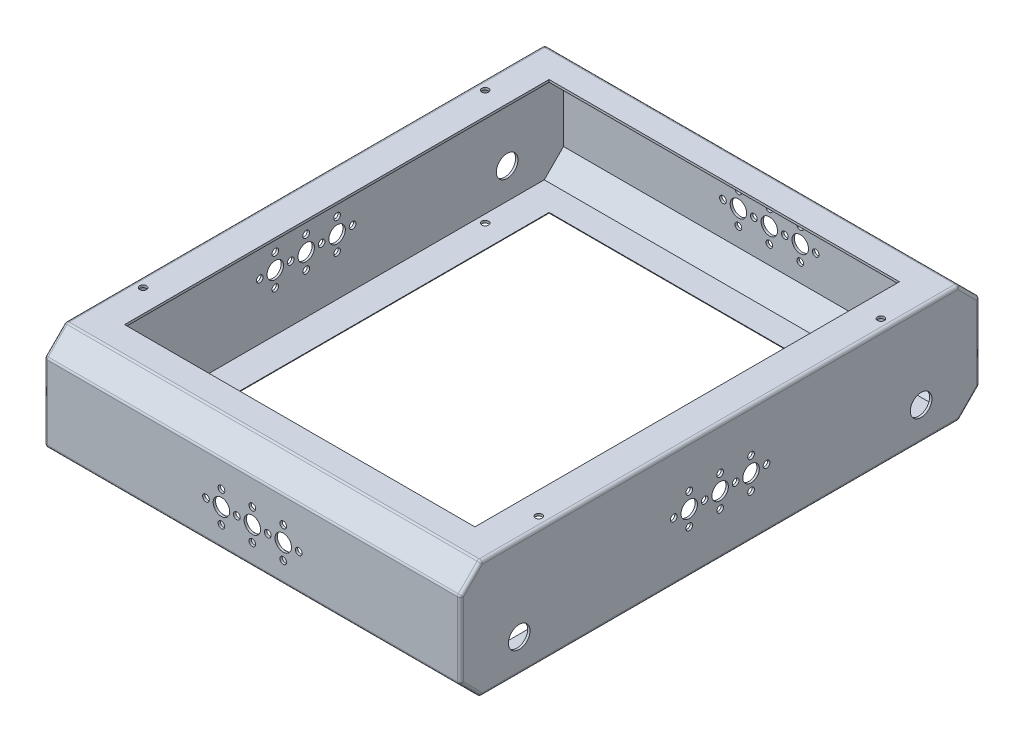
from build123d import *

# Parameters (mm, degrees)
SKETCH1_W           = 252
SKETCH1_H           = 57
BOSS_EXTRUDE1_DEPTH = 202
CUT_EXTRUDE1_DEPTH  = 328.958838881
SKETCH3_W           = 170
SKETCH3_H           = 206
CUT_EXTRUDE2_DEPTH  = 328.958838881
SHELL3_T            = -1.14
SKETCH4_R           = 4
SKETCH4_R_2         = 1.625
CUT_EXTRUDE3_DEPTH  = 328.958838881
SKETCH5_R           = 4
SKETCH5_R_2         = 1.625
CUT_EXTRUDE4_DEPTH  = 328.958838881
SKETCH6_R           = 5.25
CUT_EXTRUDE5_DEPTH  = 328.958838881
FILLET1_R           = 1.5
SKETCH7_R           = 1.65
CUT_EXTRUDE6_DEPTH  = 328.958838881


with BuildPart() as part:
    # Sketch1 → Boss-Extrude1 (new body)
    with BuildSketch(Plane(origin=(0, 0, 0), x_dir=(0, 0, -1), z_dir=(1, 0, 0))):
        with Locations((126, 28.5)):
            Rectangle(SKETCH1_W, SKETCH1_H)
    extrude(amount=BOSS_EXTRUDE1_DEPTH)

    # Sketch2 → Cut-Extrude1 (cut, through all)
    with BuildSketch(Plane.ZY):
        Polygon((-252, 47), (-242, 57), (-252, 57), align=None)
        Polygon((-252, 10), (-252, 0), (-242, 0), align=None)
        Polygon((0, 10), (-10, 0), (0, 0), align=None)
        Polygon((0, 47), (0, 57), (-10, 57), align=None)
    extrude(amount=-CUT_EXTRUDE1_DEPTH, mode=Mode.SUBTRACT)

    # Sketch3 → Cut-Extrude2 (cut, through all)
    with BuildSketch(Plane.XZ):
        with Locations((101, -126)):
            Rectangle(SKETCH3_W, SKETCH3_H)
    extrude(amount=-CUT_EXTRUDE2_DEPTH, mode=Mode.SUBTRACT)

    # Shell3
    shell3_openings = [part.faces().sort_by_distance(p)[0] for p in [
        (16, 28.5, -126),
        (101, 28.5, -23),
        (186, 28.5, -126),
        (101, 28.5, -229),
    ]]
    offset(amount=SHELL3_T, openings=shell3_openings, kind=Kind.INTERSECTION)

    # Sketch4 → Cut-Extrude3 (cut, through all)
    with BuildSketch(Plane(origin=(202, 0, 0), x_dir=(0, 0, -1), z_dir=(1, 0, 0))):
        with Locations((126, 28.5)):
            Circle(SKETCH4_R)
        with Locations((141, 28.5)):
            Circle(SKETCH4_R)
        with Locations((111, 28.5)):
            Circle(SKETCH4_R)
        with Locations((126, 36)):
            Circle(SKETCH4_R_2)
        with Locations((126, 21)):
            Circle(SKETCH4_R_2)
        with Locations((133.5, 28.5)):
            Circle(SKETCH4_R_2)
        with Locations((141, 21)):
            Circle(SKETCH4_R_2)
        with Locations((148.5, 28.5)):
            Circle(SKETCH4_R_2)
        with Locations((118.5, 28.5)):
            Circle(SKETCH4_R_2)
        with Locations((103.5, 28.5)):
            Circle(SKETCH4_R_2)
        with Locations((111, 36)):
            Circle(SKETCH4_R_2)
        with Locations((111, 21)):
            Circle(SKETCH4_R_2)
        with Locations((141, 36)):
            Circle(SKETCH4_R_2)
    extrude(amount=-CUT_EXTRUDE3_DEPTH, mode=Mode.SUBTRACT)

    # Sketch5 → Cut-Extrude4 (cut, through all)
    with BuildSketch(Plane.XY):
        with Locations((101, 26.875)):
            Circle(SKETCH5_R)
        with Locations((116, 26.875)):
            Circle(SKETCH5_R)
        with Locations((86, 26.875)):
            Circle(SKETCH5_R)
        with Locations((101, 34.375)):
            Circle(SKETCH5_R_2)
        with Locations((101, 19.375)):
            Circle(SKETCH5_R_2)
        with Locations((108.5, 26.875)):
            Circle(SKETCH5_R_2)
        with Locations((116, 19.375)):
            Circle(SKETCH5_R_2)
        with Locations((123.5, 26.875)):
            Circle(SKETCH5_R_2)
        with Locations((93.5, 26.875)):
            Circle(SKETCH5_R_2)
        with Locations((78.5, 26.875)):
            Circle(SKETCH5_R_2)
        with Locations((86, 34.375)):
            Circle(SKETCH5_R_2)
        with Locations((86, 19.375)):
            Circle(SKETCH5_R_2)
        with Locations((116, 34.375)):
            Circle(SKETCH5_R_2)
    extrude(amount=-CUT_EXTRUDE4_DEPTH, mode=Mode.SUBTRACT)

    # Sketch6 → Cut-Extrude5 (cut, through all)
    with BuildSketch(Plane(origin=(202, 0, 0), x_dir=(0, 0, -1), z_dir=(1, 0, 0))):
        with Locations((28.5, 16)):
            Circle(SKETCH6_R)
        with Locations(Location((223.5, 16, 0), (0, 0, 180))):
            Circle(SKETCH6_R)
    extrude(amount=-CUT_EXTRUDE5_DEPTH, mode=Mode.SUBTRACT)

    # Fillet1
    # the kernel refuses this fillet: 1.5 mm, written as the material it takes off along each edge
    with BuildSketch(Plane(origin=(200.5, 55.5, -241.378679656), x_dir=(0, 0.7071067811865476, -0.7071067811865476), z_dir=(1, 0, 0))) as fillet1_piece_1_section:
        Polygon((0, 0), (FILLET1_R * 1.02, 0), (FILLET1_R * 1.02, FILLET1_R * 0.422497833621), (FILLET1_R * 0.72124891681, FILLET1_R * 0.72124891681), align=None)
    fillet1_piece_1 = extrude(amount=FILLET1_R * 1.02, mode=Mode.PRIVATE)
    fillet1_piece_1 = fillet1_piece_1 - Plane(origin=(200.5, 55.5, -241.378679656), x_dir=(0, -0.9238795325112867, 0.3826834323650898), z_dir=(1, 0, 0)) * Sphere(FILLET1_R, mode=Mode.PRIVATE)
    add(fillet1_piece_1, mode=Mode.SUBTRACT)
    with BuildSketch(Plane(origin=(200.5, 55.5, -10.621320344), x_dir=(0, 0.7071067811865508, 0.7071067811865444), z_dir=(1, 0, 0))) as fillet1_piece_2_section:
        Polygon((0, 0), (FILLET1_R * 1.02, 0), (FILLET1_R * 1.02, -FILLET1_R * 0.422497833621), (FILLET1_R * 0.72124891681, -FILLET1_R * 0.72124891681), align=None)
    fillet1_piece_2 = extrude(amount=FILLET1_R * 1.02, mode=Mode.PRIVATE)
    fillet1_piece_2 = fillet1_piece_2 - Plane(origin=(200.5, 55.5, -10.621320344), x_dir=(0, -0.9238795325112876, -0.3826834323650877), z_dir=(1, 0, 0)) * Sphere(FILLET1_R, mode=Mode.PRIVATE)
    add(fillet1_piece_2, mode=Mode.SUBTRACT)
    with BuildSketch(Plane(origin=(1.5, 55.5, -241.378679656), x_dir=(0, 1, 0), z_dir=(-1, 0, 0))) as fillet1_piece_3_section:
        Polygon((0, 0), (FILLET1_R * 1.02, 0), (FILLET1_R * 1.02, FILLET1_R * 0.422497833621), (FILLET1_R * 0.72124891681, FILLET1_R * 0.72124891681), align=None)
    fillet1_piece_3 = extrude(amount=FILLET1_R * 1.02, mode=Mode.PRIVATE)
    fillet1_piece_3 = fillet1_piece_3 - Plane(origin=(1.5, 55.5, -241.378679656), x_dir=(0, -0.9238795325112867, 0.3826834323650898), z_dir=(-1, 0, 0)) * Sphere(FILLET1_R, mode=Mode.PRIVATE)
    add(fillet1_piece_3, mode=Mode.SUBTRACT)
    with BuildSketch(Plane(origin=(1.5, 55.5, -10.621320344), x_dir=(0, 0.7071067811865508, 0.7071067811865444), z_dir=(-1, 0, 0))) as fillet1_piece_4_section:
        Polygon((0, 0), (FILLET1_R * 1.02, 0), (FILLET1_R * 1.02, FILLET1_R * 0.422497833621), (FILLET1_R * 0.72124891681, FILLET1_R * 0.72124891681), align=None)
    fillet1_piece_4 = extrude(amount=FILLET1_R * 1.02, mode=Mode.PRIVATE)
    fillet1_piece_4 = fillet1_piece_4 - Plane(origin=(1.5, 55.5, -10.621320344), x_dir=(0, -0.9238795325112876, -0.3826834323650877), z_dir=(-1, 0, 0)) * Sphere(FILLET1_R, mode=Mode.PRIVATE)
    add(fillet1_piece_4, mode=Mode.SUBTRACT)
    with BuildSketch(Plane(origin=(1.5, 10.621320344, -1.5), x_dir=(0, 0, 1), z_dir=(-1, 0, 0))) as fillet1_piece_5_section:
        Polygon((0, 0), (FILLET1_R * 1.02, 0), (FILLET1_R * 1.02, -FILLET1_R * 0.422497833621), (FILLET1_R * 0.72124891681, -FILLET1_R * 0.72124891681), align=None)
    fillet1_piece_5 = extrude(amount=FILLET1_R * 1.02, mode=Mode.PRIVATE)
    fillet1_piece_5 = fillet1_piece_5 - Plane(origin=(1.5, 10.621320344, -1.5), x_dir=(0, 0.382683432365088, -0.9238795325112874), z_dir=(-1, 0, 0)) * Sphere(FILLET1_R, mode=Mode.PRIVATE)
    add(fillet1_piece_5, mode=Mode.SUBTRACT)
    with BuildSketch(Plane(origin=(200.5, 10.621320344, -1.5), x_dir=(0, 0, 1), z_dir=(1, 0, 0))) as fillet1_piece_6_section:
        Polygon((0, 0), (FILLET1_R * 1.02, 0), (FILLET1_R * 1.02, FILLET1_R * 0.422497833621), (FILLET1_R * 0.72124891681, FILLET1_R * 0.72124891681), align=None)
    fillet1_piece_6 = extrude(amount=FILLET1_R * 1.02, mode=Mode.PRIVATE)
    fillet1_piece_6 = fillet1_piece_6 - Plane(origin=(200.5, 10.621320344, -1.5), x_dir=(0, 0.382683432365088, -0.9238795325112874), z_dir=(1, 0, 0)) * Sphere(FILLET1_R, mode=Mode.PRIVATE)
    add(fillet1_piece_6, mode=Mode.SUBTRACT)
    with BuildSketch(Plane(origin=(200.5, 1.5, -10.621320344), x_dir=(0, -1, 0), z_dir=(1, 0, 0))) as fillet1_piece_7_section:
        Polygon((0, 0), (FILLET1_R * 1.02, 0), (FILLET1_R * 1.02, -FILLET1_R * 0.422497833621), (FILLET1_R * 0.72124891681, -FILLET1_R * 0.72124891681), align=None)
    fillet1_piece_7 = extrude(amount=FILLET1_R * 1.02, mode=Mode.PRIVATE)
    fillet1_piece_7 = fillet1_piece_7 - Plane(origin=(200.5, 1.5, -10.621320344), x_dir=(0, 0.923879532511286, -0.3826834323650915), z_dir=(1, 0, 0)) * Sphere(FILLET1_R, mode=Mode.PRIVATE)
    add(fillet1_piece_7, mode=Mode.SUBTRACT)
    with BuildSketch(Plane(origin=(1.5, 1.5, -10.621320344), x_dir=(0, -0.7071067811865448, 0.7071067811865502), z_dir=(-1, 0, 0))) as fillet1_piece_8_section:
        Polygon((0, 0), (FILLET1_R * 1.02, 0), (FILLET1_R * 1.02, -FILLET1_R * 0.422497833621), (FILLET1_R * 0.72124891681, -FILLET1_R * 0.72124891681), align=None)
    fillet1_piece_8 = extrude(amount=FILLET1_R * 1.02, mode=Mode.PRIVATE)
    fillet1_piece_8 = fillet1_piece_8 - Plane(origin=(1.5, 1.5, -10.621320344), x_dir=(0, 0.923879532511286, -0.3826834323650915), z_dir=(-1, 0, 0)) * Sphere(FILLET1_R, mode=Mode.PRIVATE)
    add(fillet1_piece_8, mode=Mode.SUBTRACT)
    with BuildSketch(Plane(origin=(200.5, 46.378679656, -1.5), x_dir=(0, 0, 1), z_dir=(1, 0, 0))) as fillet1_piece_9_section:
        Polygon((0, 0), (FILLET1_R * 1.02, 0), (FILLET1_R * 1.02, -FILLET1_R * 0.422497833621), (FILLET1_R * 0.72124891681, -FILLET1_R * 0.72124891681), align=None)
    fillet1_piece_9 = extrude(amount=FILLET1_R * 1.02, mode=Mode.PRIVATE)
    fillet1_piece_9 = fillet1_piece_9 - Plane(origin=(200.5, 46.378679656, -1.5), x_dir=(0, -0.3826834323650919, -0.923879532511286), z_dir=(1, 0, 0)) * Sphere(FILLET1_R, mode=Mode.PRIVATE)
    add(fillet1_piece_9, mode=Mode.SUBTRACT)
    with BuildSketch(Plane(origin=(1.5, 46.378679656, -1.5), x_dir=(0, 0, 1), z_dir=(-1, 0, 0))) as fillet1_piece_10_section:
        Polygon((0, 0), (FILLET1_R * 1.02, 0), (FILLET1_R * 1.02, FILLET1_R * 0.422497833621), (FILLET1_R * 0.72124891681, FILLET1_R * 0.72124891681), align=None)
    fillet1_piece_10 = extrude(amount=FILLET1_R * 1.02, mode=Mode.PRIVATE)
    fillet1_piece_10 = fillet1_piece_10 - Plane(origin=(1.5, 46.378679656, -1.5), x_dir=(0, -0.3826834323650919, -0.923879532511286), z_dir=(-1, 0, 0)) * Sphere(FILLET1_R, mode=Mode.PRIVATE)
    add(fillet1_piece_10, mode=Mode.SUBTRACT)
    with BuildSketch(Plane(origin=(1.5, 1.5, -241.378679656), x_dir=(0, -0.7071067811865475, -0.7071067811865476), z_dir=(-1, 0, 0))) as fillet1_piece_11_section:
        Polygon((0, 0), (FILLET1_R * 1.02, 0), (FILLET1_R * 1.02, FILLET1_R * 0.422497833621), (FILLET1_R * 0.72124891681, FILLET1_R * 0.72124891681), align=None)
    fillet1_piece_11 = extrude(amount=FILLET1_R * 1.02, mode=Mode.PRIVATE)
    fillet1_piece_11 = fillet1_piece_11 - Plane(origin=(1.5, 1.5, -241.378679656), x_dir=(0, 0.9238795325112867, 0.3826834323650898), z_dir=(-1, 0, 0)) * Sphere(FILLET1_R, mode=Mode.PRIVATE)
    add(fillet1_piece_11, mode=Mode.SUBTRACT)
    with BuildSketch(Plane(origin=(200.5, 1.5, -241.378679656), x_dir=(0, -1, 0), z_dir=(1, 0, 0))) as fillet1_piece_12_section:
        Polygon((0, 0), (FILLET1_R * 1.02, 0), (FILLET1_R * 1.02, FILLET1_R * 0.422497833621), (FILLET1_R * 0.72124891681, FILLET1_R * 0.72124891681), align=None)
    fillet1_piece_12 = extrude(amount=FILLET1_R * 1.02, mode=Mode.PRIVATE)
    fillet1_piece_12 = fillet1_piece_12 - Plane(origin=(200.5, 1.5, -241.378679656), x_dir=(0, 0.9238795325112867, 0.3826834323650898), z_dir=(1, 0, 0)) * Sphere(FILLET1_R, mode=Mode.PRIVATE)
    add(fillet1_piece_12, mode=Mode.SUBTRACT)
    with BuildSketch(Plane(origin=(200.5, 10.621320344, -250.5), x_dir=(0, 0, -1), z_dir=(1, 0, 0))) as fillet1_piece_13_section:
        Polygon((0, 0), (FILLET1_R * 1.02, 0), (FILLET1_R * 1.02, -FILLET1_R * 0.422497833621), (FILLET1_R * 0.72124891681, -FILLET1_R * 0.72124891681), align=None)
    fillet1_piece_13 = extrude(amount=FILLET1_R * 1.02, mode=Mode.PRIVATE)
    fillet1_piece_13 = fillet1_piece_13 - Plane(origin=(200.5, 10.621320344, -250.5), x_dir=(0, 0.3826834323650897, 0.9238795325112867), z_dir=(1, 0, 0)) * Sphere(FILLET1_R, mode=Mode.PRIVATE)
    add(fillet1_piece_13, mode=Mode.SUBTRACT)
    with BuildSketch(Plane(origin=(1.5, 10.621320344, -250.5), x_dir=(0, -0.7071067811865475, -0.7071067811865476), z_dir=(-1, 0, 0))) as fillet1_piece_14_section:
        Polygon((0, 0), (FILLET1_R * 1.02, 0), (FILLET1_R * 1.02, -FILLET1_R * 0.422497833621), (FILLET1_R * 0.72124891681, -FILLET1_R * 0.72124891681), align=None)
    fillet1_piece_14 = extrude(amount=FILLET1_R * 1.02, mode=Mode.PRIVATE)
    fillet1_piece_14 = fillet1_piece_14 - Plane(origin=(1.5, 10.621320344, -250.5), x_dir=(0, 0.3826834323650897, 0.9238795325112867), z_dir=(-1, 0, 0)) * Sphere(FILLET1_R, mode=Mode.PRIVATE)
    add(fillet1_piece_14, mode=Mode.SUBTRACT)
    with BuildSketch(Plane(origin=(1.5, 46.378679656, -250.5), x_dir=(0, 0, -1), z_dir=(-1, 0, 0))) as fillet1_piece_15_section:
        Polygon((0, 0), (FILLET1_R * 1.02, 0), (FILLET1_R * 1.02, -FILLET1_R * 0.422497833621), (FILLET1_R * 0.72124891681, -FILLET1_R * 0.72124891681), align=None)
    fillet1_piece_15 = extrude(amount=FILLET1_R * 1.02, mode=Mode.PRIVATE)
    fillet1_piece_15 = fillet1_piece_15 - Plane(origin=(1.5, 46.378679656, -250.5), x_dir=(0, -0.3826834323650898, 0.9238795325112867), z_dir=(-1, 0, 0)) * Sphere(FILLET1_R, mode=Mode.PRIVATE)
    add(fillet1_piece_15, mode=Mode.SUBTRACT)
    with BuildSketch(Plane(origin=(200.5, 46.378679656, -250.5), x_dir=(0, 0, -1), z_dir=(1, 0, 0))) as fillet1_piece_16_section:
        Polygon((0, 0), (FILLET1_R * 1.02, 0), (FILLET1_R * 1.02, FILLET1_R * 0.422497833621), (FILLET1_R * 0.72124891681, FILLET1_R * 0.72124891681), align=None)
    fillet1_piece_16 = extrude(amount=FILLET1_R * 1.02, mode=Mode.PRIVATE)
    fillet1_piece_16 = fillet1_piece_16 - Plane(origin=(200.5, 46.378679656, -250.5), x_dir=(0, -0.3826834323650898, 0.9238795325112867), z_dir=(1, 0, 0)) * Sphere(FILLET1_R, mode=Mode.PRIVATE)
    add(fillet1_piece_16, mode=Mode.SUBTRACT)
    with BuildSketch(Plane(origin=(202, 57, -241.378679656), x_dir=(0, -1, 0), z_dir=(0, 0, 1)), Plane(origin=(0, 0, -10.621320344), x_dir=(1, 0, 0), z_dir=(0, 0, -1))) as fillet1_piece_17:
        with BuildLine():
            CenterArc((FILLET1_R, -FILLET1_R), FILLET1_R, 90, 90)
            Line((0, -FILLET1_R), (-FILLET1_R * 0.02, -FILLET1_R))
            Line((-FILLET1_R * 0.02, -FILLET1_R), (-FILLET1_R * 0.02, FILLET1_R * 0.02))
            Line((-FILLET1_R * 0.02, FILLET1_R * 0.02), (FILLET1_R, FILLET1_R * 0.02))
            Line((FILLET1_R, FILLET1_R * 0.02), (FILLET1_R, 0))
        make_face()
    extrude(amount=230.757359313, mode=Mode.SUBTRACT)
    with BuildSketch(Plane(origin=(0, 57, -241.378679656), x_dir=(0, -1, 0), z_dir=(0, 0, 1)), Plane(origin=(202, 0, -10.621320344), x_dir=(-1, 0, 0), z_dir=(0, 0, -1))) as fillet1_piece_18:
        with BuildLine():
            CenterArc((FILLET1_R, FILLET1_R), FILLET1_R, 180, 90)
            Line((0, FILLET1_R), (-FILLET1_R * 0.02, FILLET1_R))
            Line((-FILLET1_R * 0.02, FILLET1_R), (-FILLET1_R * 0.02, -FILLET1_R * 0.02))
            Line((-FILLET1_R * 0.02, -FILLET1_R * 0.02), (FILLET1_R, -FILLET1_R * 0.02))
            Line((FILLET1_R, -FILLET1_R * 0.02), (FILLET1_R, 0))
        make_face()
    extrude(amount=230.757359313, mode=Mode.SUBTRACT)
    with BuildSketch(Plane(origin=(1.5, 10, 0), x_dir=(0, -0.7071067811865495, -0.7071067811865455), z_dir=(1, 0, 0)), Plane(origin=(1.5, 57, -10), x_dir=(0, -0.7071067811865418, 0.7071067811865532), z_dir=(1, 0, 0)), Plane(origin=(1.5, 47, 0), x_dir=(0, -1, 0), z_dir=(1, 0, 0)), Plane(origin=(1.5, 0, -10), x_dir=(0, -1.42950159109809e-12, -1.0), z_dir=(1, 0, 0)), Plane(origin=(1.5, 57, -242), x_dir=(0, 0, 1), z_dir=(1, 0, 0))) as fillet1_piece_19:
        with BuildLine():
            CenterArc((FILLET1_R * 0.414213562373, FILLET1_R), FILLET1_R, 225, 45)
            Line((-FILLET1_R * 0.292893218813, FILLET1_R * 0.292893218813), (-FILLET1_R * 0.307035354437, FILLET1_R * 0.27875108319))
            Line((-FILLET1_R * 0.307035354437, FILLET1_R * 0.27875108319), (-FILLET1_R * 0.00828427124746, -FILLET1_R * 0.02))
            Line((-FILLET1_R * 0.00828427124746, -FILLET1_R * 0.02), (FILLET1_R * 0.414213562373, -FILLET1_R * 0.02))
            Line((FILLET1_R * 0.414213562373, -FILLET1_R * 0.02), (FILLET1_R * 0.414213562373, 0))
        make_face()
    extrude(amount=199, mode=Mode.SUBTRACT)
    with BuildSketch(Plane(origin=(202, 0.439339828, -9.560660172), x_dir=(-1, 0, 0), z_dir=(0, 0.7071067811865502, 0.7071067811865448)), Plane(origin=(202, 9.560660172, -251.560660172), x_dir=(-1, 0, 0), z_dir=(0, -0.7071067811865476, 0.7071067811865475))) as fillet1_piece_20:
        with BuildLine():
            CenterArc((FILLET1_R, -FILLET1_R), FILLET1_R, 90, 90)
            Line((0, -FILLET1_R), (-FILLET1_R * 0.02, -FILLET1_R))
            Line((-FILLET1_R * 0.02, -FILLET1_R), (-FILLET1_R * 0.02, FILLET1_R * 0.02))
            Line((-FILLET1_R * 0.02, FILLET1_R * 0.02), (FILLET1_R, FILLET1_R * 0.02))
            Line((FILLET1_R, FILLET1_R * 0.02), (FILLET1_R, 0))
        make_face()
    extrude(amount=12.899494937, mode=Mode.SUBTRACT)
    with BuildSketch(Plane(origin=(0, 9.560660172, -0.439339828), x_dir=(0, 0.7071067811865448, -0.7071067811865503), z_dir=(0, -0.7071067811865502, -0.7071067811865448)), Plane(origin=(202, 47.439339828, -0.439339828), x_dir=(-1.8947806286936042e-14, -0.7071067811865508, -0.7071067811865442), z_dir=(0, 0.7071067811865444, -0.7071067811865508)), Plane(origin=(0, 56.560660172, -9.560660172), x_dir=(0, -0.7071067811865508, -0.7071067811865442), z_dir=(0, -0.7071067811865444, 0.7071067811865508)), Plane(origin=(0, 0.439339828, -242.439339828), x_dir=(0, 0.7071067811865475, 0.7071067811865475), z_dir=(0, 0.7071067811865476, -0.7071067811865475)), Plane(origin=(202, 56.560660172, -242.439339828), x_dir=(-1.8947806286935916e-14, -0.7071067811865475, 0.7071067811865475), z_dir=(0, -0.7071067811865476, -0.7071067811865476)), Plane(origin=(0, 47.439339828, -251.560660172), x_dir=(0, -0.7071067811865475, 0.7071067811865475), z_dir=(0, 0.7071067811865476, 0.7071067811865476))) as fillet1_piece_21:
        with BuildLine():
            CenterArc((FILLET1_R, FILLET1_R), FILLET1_R, 180, 90)
            Line((0, FILLET1_R), (-FILLET1_R * 0.02, FILLET1_R))
            Line((-FILLET1_R * 0.02, FILLET1_R), (-FILLET1_R * 0.02, -FILLET1_R * 0.02))
            Line((-FILLET1_R * 0.02, -FILLET1_R * 0.02), (FILLET1_R, -FILLET1_R * 0.02))
            Line((FILLET1_R, -FILLET1_R * 0.02), (FILLET1_R, 0))
        make_face()
    extrude(amount=12.899494937, mode=Mode.SUBTRACT)
    with BuildSketch(Plane(origin=(186, 0, -23), x_dir=(1, 0, 0), z_dir=(0, 0, -1)), Plane(origin=(16, 0, -229), x_dir=(-1, 0, 0), z_dir=(0, 0, 1))) as fillet1_piece_22:
        with BuildLine():
            CenterArc((1.456159332, -1.5), FILLET1_R, 90, 76.113459637)
            Line((0, -1.14), (-0.029123187, -1.1328))
            ThreePointArc((-0.029123187, -1.1328), (-0.03, -0.57), (-0.03, 0))
            Line((-0.03, 0), (0, 0.03))
            Line((0, 0.03), (1.456159332, 0.03))
            Line((1.456159332, 0.03), (1.456159332, 0))
        make_face()
    extrude(amount=206, mode=Mode.SUBTRACT)
    with BuildSketch(Plane(origin=(16, 0, -23), x_dir=(0, 0, 1), z_dir=(1, 0, 0)), Plane(origin=(186, 0, -229), x_dir=(0, 0, -1), z_dir=(-1, 0, 0))) as fillet1_piece_23:
        with BuildLine():
            CenterArc((1.456159332, -1.5), FILLET1_R, 90, 76.113459637)
            Line((0, -1.14), (-0.029123187, -1.1328))
            ThreePointArc((-0.029123187, -1.1328), (-0.03, -0.57), (-0.03, 0))
            Line((-0.03, 0), (0, 0.03))
            Line((0, 0.03), (1.456159332, 0.03))
            Line((1.456159332, 0.03), (1.456159332, 0))
        make_face()
    extrude(amount=170, mode=Mode.SUBTRACT)
    with BuildSketch(Plane(origin=(1.5, 0, -242), x_dir=(0, 0, 1), z_dir=(1, 0, 0)), Plane(origin=(1.5, 10, -252), x_dir=(0, -0.7071067811865389, 0.7071067811865561), z_dir=(1, 0, 0)), Plane(origin=(1.5, 47, -252), x_dir=(0, -1, 0), z_dir=(1, 0, 0))) as fillet1_piece_24:
        with BuildLine():
            CenterArc((FILLET1_R * 0.414213562373, -FILLET1_R), FILLET1_R, 90, 45)
            Line((-FILLET1_R * 0.292893218813, -FILLET1_R * 0.292893218813), (-FILLET1_R * 0.307035354437, -FILLET1_R * 0.27875108319))
            Line((-FILLET1_R * 0.307035354437, -FILLET1_R * 0.27875108319), (-FILLET1_R * 0.00828427124746, FILLET1_R * 0.02))
            Line((-FILLET1_R * 0.00828427124746, FILLET1_R * 0.02), (FILLET1_R * 0.414213562373, FILLET1_R * 0.02))
            Line((FILLET1_R * 0.414213562373, FILLET1_R * 0.02), (FILLET1_R * 0.414213562373, 0))
        make_face()
    extrude(amount=199, mode=Mode.SUBTRACT)
    with BuildSketch(Plane(origin=(202, 46.378679656, 0), x_dir=(0, 0, -1), z_dir=(0, -1, 0)), Plane(origin=(202, 10.621320344, -252), x_dir=(0, 0, 1), z_dir=(0, 1, 0))) as fillet1_piece_25:
        with BuildLine():
            CenterArc((FILLET1_R, -FILLET1_R), FILLET1_R, 90, 90)
            Line((0, -FILLET1_R), (-FILLET1_R * 0.02, -FILLET1_R))
            Line((-FILLET1_R * 0.02, -FILLET1_R), (-FILLET1_R * 0.02, FILLET1_R * 0.02))
            Line((-FILLET1_R * 0.02, FILLET1_R * 0.02), (FILLET1_R, FILLET1_R * 0.02))
            Line((FILLET1_R, FILLET1_R * 0.02), (FILLET1_R, 0))
        make_face()
    extrude(amount=35.757359313, mode=Mode.SUBTRACT)
    with BuildSketch(Plane(origin=(0, 46.378679656, 0), x_dir=(0, 0, -1), z_dir=(0, -1, 0)), Plane(origin=(0, 10.621320344, -252), x_dir=(0, 0, 1), z_dir=(0, 1, 0))) as fillet1_piece_26:
        with BuildLine():
            CenterArc((FILLET1_R, FILLET1_R), FILLET1_R, 180, 90)
            Line((0, FILLET1_R), (-FILLET1_R * 0.02, FILLET1_R))
            Line((-FILLET1_R * 0.02, FILLET1_R), (-FILLET1_R * 0.02, -FILLET1_R * 0.02))
            Line((-FILLET1_R * 0.02, -FILLET1_R * 0.02), (FILLET1_R, -FILLET1_R * 0.02))
            Line((FILLET1_R, -FILLET1_R * 0.02), (FILLET1_R, 0))
        make_face()
    extrude(amount=35.757359313, mode=Mode.SUBTRACT)
    with BuildSketch(Plane(origin=(16, 0, -23), x_dir=(0, 0, 1), z_dir=(1, 0, 0))) as fillet1_piece_27a_section:
        with BuildLine():
            CenterArc((1.456159332, -1.5), FILLET1_R, 90, 76.113459637)
            Line((0, -1.14), (-0.029123187, -1.1328))
            ThreePointArc((-0.029123187, -1.1328), (-0.03, -0.57), (-0.03, 0))
            Line((-0.03, 0), (0, 0.03))
            Line((0, 0.03), (1.456159332, 0.03))
            Line((1.456159332, 0.03), (1.456159332, 0))
        make_face()
    fillet1_piece_27a = extrude(amount=173.64039833, mode=Mode.PRIVATE)
    fillet1_piece_27a = split(fillet1_piece_27a, bisect_by=Plane(origin=(186, 0.287486667, -22.657579207), z_dir=(1, 0, 0)), keep=Keep.TOP, mode=Mode.PRIVATE)
    with BuildSketch(Plane(origin=(186, 0, -19.35960167), x_dir=(1, 0, 0), z_dir=(0, 0, -1))) as fillet1_piece_27b_section:
        with BuildLine():
            CenterArc((1.456159332, -1.5), FILLET1_R, 90, 76.113459637)
            Line((0, -1.14), (-0.029123187, -1.1328))
            ThreePointArc((-0.029123187, -1.1328), (-0.03, -0.57), (-0.03, 0))
            Line((-0.03, 0), (0, 0.03))
            Line((0, 0.03), (1.456159332, 0.03))
            Line((1.456159332, 0.03), (1.456159332, 0))
        make_face()
    fillet1_piece_27b = extrude(amount=209.64039833, mode=Mode.PRIVATE)
    fillet1_piece_27b = split(fillet1_piece_27b, bisect_by=Plane(origin=(186.342420793, 0.287486667, -23), z_dir=(0, 0, 1)), keep=Keep.TOP, mode=Mode.PRIVATE)
    fillet1_piece_27 = fillet1_piece_27a & fillet1_piece_27b
    add(fillet1_piece_27, mode=Mode.SUBTRACT)
    with BuildSketch(Plane(origin=(186, 0, -23), x_dir=(1, 0, 0), z_dir=(0, 0, -1))) as fillet1_piece_28a_section:
        with BuildLine():
            CenterArc((1.456159332, -1.5), FILLET1_R, 90, 76.113459637)
            Line((0, -1.14), (-0.029123187, -1.1328))
            ThreePointArc((-0.029123187, -1.1328), (-0.03, -0.57), (-0.03, 0))
            Line((-0.03, 0), (0, 0.03))
            Line((0, 0.03), (1.456159332, 0.03))
            Line((1.456159332, 0.03), (1.456159332, 0))
        make_face()
    fillet1_piece_28a = extrude(amount=209.64039833, mode=Mode.PRIVATE)
    fillet1_piece_28a = split(fillet1_piece_28a, bisect_by=Plane(origin=(186.342420793, 0.287486667, -229), z_dir=(0, 0, -1)), keep=Keep.TOP, mode=Mode.PRIVATE)
    with BuildSketch(Plane(origin=(189.64039833, 0, -229), x_dir=(0, 0, -1), z_dir=(-1, 0, 0))) as fillet1_piece_28b_section:
        with BuildLine():
            CenterArc((1.456159332, -1.5), FILLET1_R, 90, 76.113459637)
            Line((0, -1.14), (-0.029123187, -1.1328))
            ThreePointArc((-0.029123187, -1.1328), (-0.03, -0.57), (-0.03, 0))
            Line((-0.03, 0), (0, 0.03))
            Line((0, 0.03), (1.456159332, 0.03))
            Line((1.456159332, 0.03), (1.456159332, 0))
        make_face()
    fillet1_piece_28b = extrude(amount=173.64039833, mode=Mode.PRIVATE)
    fillet1_piece_28b = split(fillet1_piece_28b, bisect_by=Plane(origin=(186, 0.287486667, -229.342420793), z_dir=(1, 0, 0)), keep=Keep.TOP, mode=Mode.PRIVATE)
    fillet1_piece_28 = fillet1_piece_28a & fillet1_piece_28b
    add(fillet1_piece_28, mode=Mode.SUBTRACT)
    with BuildSketch(Plane(origin=(12.35960167, 0, -23), x_dir=(0, 0, 1), z_dir=(1, 0, 0))) as fillet1_piece_29a_section:
        with BuildLine():
            CenterArc((1.456159332, -1.5), FILLET1_R, 90, 76.113459637)
            Line((0, -1.14), (-0.029123187, -1.1328))
            ThreePointArc((-0.029123187, -1.1328), (-0.03, -0.57), (-0.03, 0))
            Line((-0.03, 0), (0, 0.03))
            Line((0, 0.03), (1.456159332, 0.03))
            Line((1.456159332, 0.03), (1.456159332, 0))
        make_face()
    fillet1_piece_29a = extrude(amount=173.64039833, mode=Mode.PRIVATE)
    fillet1_piece_29a = split(fillet1_piece_29a, bisect_by=Plane(origin=(16, 0.287486667, -22.657579207), z_dir=(-1, 0, 0)), keep=Keep.TOP, mode=Mode.PRIVATE)
    with BuildSketch(Plane(origin=(16, 0, -229), x_dir=(-1, 0, 0), z_dir=(0, 0, 1))) as fillet1_piece_29b_section:
        with BuildLine():
            CenterArc((1.456159332, -1.5), FILLET1_R, 90, 76.113459637)
            Line((0, -1.14), (-0.029123187, -1.1328))
            ThreePointArc((-0.029123187, -1.1328), (-0.03, -0.57), (-0.03, 0))
            Line((-0.03, 0), (0, 0.03))
            Line((0, 0.03), (1.456159332, 0.03))
            Line((1.456159332, 0.03), (1.456159332, 0))
        make_face()
    fillet1_piece_29b = extrude(amount=209.64039833, mode=Mode.PRIVATE)
    fillet1_piece_29b = split(fillet1_piece_29b, bisect_by=Plane(origin=(15.657579207, 0.287486667, -23), z_dir=(0, 0, 1)), keep=Keep.TOP, mode=Mode.PRIVATE)
    fillet1_piece_29 = fillet1_piece_29a & fillet1_piece_29b
    add(fillet1_piece_29, mode=Mode.SUBTRACT)
    with BuildSketch(Plane(origin=(186, 0, -229), x_dir=(0, 0, -1), z_dir=(-1, 0, 0))) as fillet1_piece_30a_section:
        with BuildLine():
            CenterArc((1.456159332, -1.5), FILLET1_R, 90, 76.113459637)
            Line((0, -1.14), (-0.029123187, -1.1328))
            ThreePointArc((-0.029123187, -1.1328), (-0.03, -0.57), (-0.03, 0))
            Line((-0.03, 0), (0, 0.03))
            Line((0, 0.03), (1.456159332, 0.03))
            Line((1.456159332, 0.03), (1.456159332, 0))
        make_face()
    fillet1_piece_30a = extrude(amount=173.64039833, mode=Mode.PRIVATE)
    fillet1_piece_30a = split(fillet1_piece_30a, bisect_by=Plane(origin=(16, 0.287486667, -229.342420793), z_dir=(-1, 0, 0)), keep=Keep.TOP, mode=Mode.PRIVATE)
    with BuildSketch(Plane(origin=(16, 0, -232.64039833), x_dir=(-1, 0, 0), z_dir=(0, 0, 1))) as fillet1_piece_30b_section:
        with BuildLine():
            CenterArc((1.456159332, -1.5), FILLET1_R, 90, 76.113459637)
            Line((0, -1.14), (-0.029123187, -1.1328))
            ThreePointArc((-0.029123187, -1.1328), (-0.03, -0.57), (-0.03, 0))
            Line((-0.03, 0), (0, 0.03))
            Line((0, 0.03), (1.456159332, 0.03))
            Line((1.456159332, 0.03), (1.456159332, 0))
        make_face()
    fillet1_piece_30b = extrude(amount=209.64039833, mode=Mode.PRIVATE)
    fillet1_piece_30b = split(fillet1_piece_30b, bisect_by=Plane(origin=(15.657579207, 0.287486667, -229), z_dir=(0, 0, -1)), keep=Keep.TOP, mode=Mode.PRIVATE)
    fillet1_piece_30 = fillet1_piece_30a & fillet1_piece_30b
    add(fillet1_piece_30, mode=Mode.SUBTRACT)

    # Sketch7 → Cut-Extrude6 (cut, through all)
    with BuildSketch(Plane(origin=(0, 57, 0), x_dir=(1, 0, 0), z_dir=(0, 1, 0))):
        with Locations(Location((5, 209, 0), (0, 0, 270))):
            Circle(SKETCH7_R)
        with Locations(Location((197, 209, 0), (0, 0, 270))):
            Circle(SKETCH7_R)
        with Locations(Location((197, 43, 0), (0, 0, 270))):
            Circle(SKETCH7_R)
        with Locations(Location((5, 43, 0), (0, 0, 270))):
            Circle(SKETCH7_R)
    extrude(amount=-CUT_EXTRUDE6_DEPTH, mode=Mode.SUBTRACT)


solid = part.part
